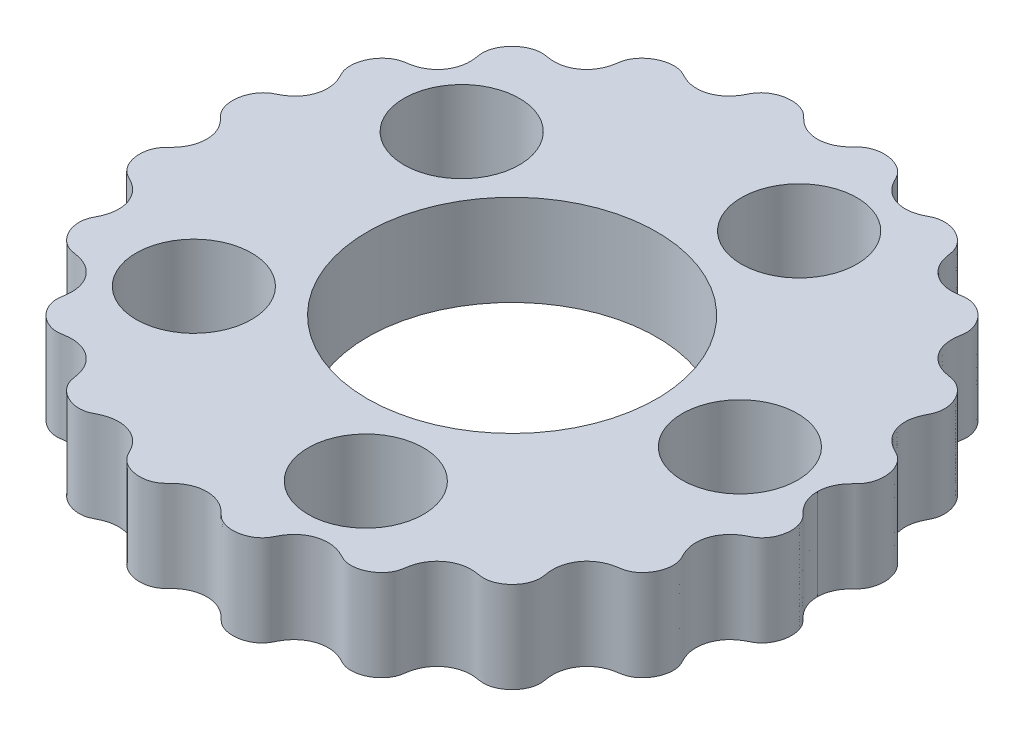
from build123d import *

# Parameters (mm, degrees)
BOSS_EXTRUDE1_START = 1
MAIN_R              = 3.8
MAIN_R_2            = 9.525
BOSS_EXTRUDE1_DEPTH = 6


with BuildPart() as part:
    # MAIN → Boss-Extrude1 (new body)
    with BuildSketch(Plane(origin=(0, 0, 0), x_dir=(1, 0, 0), z_dir=(0, 1, 0)).offset(BOSS_EXTRUDE1_START)):
        with BuildLine():
            add(Edge.make_bspline(
                [(20.1, 0), (20.1, 0.016049474), (20.10042819, 0.048265255), (20.102997256, 0.122217827), (20.111980932, 0.241772144), (20.129908594, 0.365784261), (20.160482731, 0.510263145), (20.200949467, 0.651927408), (20.251052975, 0.790295326), (20.310457626, 0.925031815), (20.405026773, 1.105489785), (20.522557341, 1.284294211), (20.663651728, 1.457905797), (20.825054173, 1.626232115), (20.958535869, 1.756480173), (21.084001151, 1.894913118), (21.19070215, 2.048527229), (21.322181138, 2.295585844), (21.436381782, 2.652555263), (21.480312105, 3.117719001), (21.403906438, 3.600484736), (21.255410516, 3.988503115), (21.088113178, 4.266212931), (20.940586592, 4.45153473), (20.783892784, 4.60313609), (20.624163597, 4.722840948), (20.449787935, 4.819202), (20.27144251, 4.907182077), (20.053826972, 5.02775347), (19.772663447, 5.220092779), (19.460268988, 5.522133789), (19.170367617, 5.979141351), (19.000054809, 6.550986456), (18.996788488, 7.09347867), (19.100354653, 7.522100535), (19.22600522, 7.825047936), (19.323069978, 8.019726709), (19.403208808, 8.17418946), (19.489181816, 8.374410265), (19.566475444, 8.682529861), (19.577864851, 9.101072271), (19.464679992, 9.610899865), (19.231249329, 10.06169528), (18.951631481, 10.396325325), (18.687316384, 10.612198661), (18.478605363, 10.738828373), (18.27672622, 10.826592284), (18.088022057, 10.880549413), (17.894642882, 10.91173651), (17.701344091, 10.941923543), (17.509848243, 10.983109484), (17.321856927, 11.038173185), (17.054914968, 11.140977964), (16.724922472, 11.324678262), (16.36394906, 11.636125273), (16.04411147, 12.112470544), (15.877508027, 12.614075001), (15.840960492, 13.04599222), (15.865791708, 13.378406904), (15.901121962, 13.611045435), (15.931904955, 13.796812252), (15.948155089, 14.03214825), (15.914834064, 14.353727504), (15.78710039, 14.744710058), (15.520698222, 15.177621098), (15.172973033, 15.516306183), (14.815895064, 15.740926601), (14.502994467, 15.864191931), (14.267579789, 15.921315139), (14.048828919, 15.944131552), (13.851076664, 15.938715819), (13.655902731, 15.909039398), (13.461304909, 15.877385295), (13.264984922, 15.856779828), (13.067674425, 15.850574212), (12.776173172, 15.865678978), (12.395590433, 15.940956671), (11.938569212, 16.137109085), (11.470553416, 16.519893429), (11.162879572, 16.97049216), (11.008945031, 17.382763009), (10.941723246, 17.700684498), (10.909391818, 17.910609622), (10.88131532, 18.078311006), (10.825896286, 18.28384026), (10.700795847, 18.566487319), (10.463238575, 18.896536387), (10.10649369, 19.20329467), (9.672270844, 19.42958383), (9.232677179, 19.551096678), (8.86266136, 19.576275628), (8.573868633, 19.540840142), (8.371319786, 19.482977256), (8.233500913, 19.429263516), (8.108846995, 19.36980218), (7.971859121, 19.298414607), (7.817815897, 19.224247184), (7.620319341, 19.142348296), (7.375175899, 19.065537121), (7.059284278, 19.008648031), (6.674311347, 19.005623312), (6.23487299, 19.085333044), (5.767240847, 19.286472452), (5.38043875, 19.585271088), (5.114615337, 19.91251743), (4.953608216, 20.183713005), (4.838337688, 20.408845665), (4.72360429, 20.635366187), (4.500791609, 20.915757491), (4.133761058, 21.194811415), (3.650572556, 21.401524152), (3.141425397, 21.474182478), (2.701085807, 21.439094531), (2.367723237, 21.345707693), (2.140403794, 21.245160735), (1.970791827, 21.139493932), (1.852684175, 21.04557956), (1.760619588, 20.960149721), (1.689220401, 20.8894654), (1.618180579, 20.81844632), (1.5460278, 20.748562596), (1.453458035, 20.663707945), (1.33785031, 20.566946935), (1.195706387, 20.46317673), (0.944410243, 20.311151454), (0.586883972, 20.160779511), (0.097411097, 20.067712928), (-0.506706748, 20.123705295), (-1.010623007, 20.324911261), (-1.364703608, 20.576832472), (-1.593509044, 20.792533664), (-1.731815119, 20.932868041), (-1.846227845, 21.041471908), (-2.001916865, 21.162825929), (-2.254686782, 21.308029569), (-2.62139071, 21.431603659), (-3.111950077, 21.479440319), (-3.664222652, 21.395690883), (-4.133751672, 21.194811679), (-4.50079738, 20.915757334), (-4.723600954, 20.635366277), (-4.838339701, 20.408845611), (-4.95360724, 20.183713031), (-5.114615975, 19.912517413), (-5.380438356, 19.585271099), (-5.767241074, 19.286472446), (-6.23487286, 19.085333048), (-6.674311426, 19.00562331), (-7.059284219, 19.008648033), (-7.37517594, 19.06553712), (-7.620319317, 19.142348297), (-7.817815908, 19.224247184), (-7.971859116, 19.298414607), (-8.108846996, 19.36980218), (-8.233500913, 19.429263515), (-8.371319785, 19.482977259), (-8.573868636, 19.540840136), (-8.862661354, 19.57627564), (-9.232677188, 19.551096661), (-9.672270832, 19.429583855), (-10.106493713, 19.203294623), (-10.463238537, 18.896536464), (-10.7007959, 18.566487209), (-10.825896203, 18.283840429), (-10.881315502, 18.078310633), (-10.909391314, 17.910610649), (-10.941724273, 17.700682406), (-11.008943, 17.382767148), (-11.162882957, 16.970485259), (-11.470548885, 16.519902665), (-11.938575656, 16.137095951), (-12.441451846, 15.92129044), (-12.874268252, 15.849349026), (-13.215931604, 15.851574086), (-13.461292159, 15.877411282), (-13.65590942, 15.909025764), (-13.851073848, 15.938721557), (-14.048830186, 15.944128969), (-14.267579135, 15.921316472), (-14.502994784, 15.864191285), (-14.815894857, 15.740927023), (-15.172973177, 15.516305889), (-15.520698126, 15.177621293), (-15.787100449, 14.744709937), (-15.914834028, 14.353727576), (-15.948155108, 14.032148211), (-15.931904943, 13.796812277), (-15.901121967, 13.611045423), (-15.865791705, 13.37840691), (-15.840960494, 13.045992217), (-15.877508026, 12.614075003), (-16.044111471, 12.112470543), (-16.363949059, 11.636125274), (-16.724922472, 11.324678262), (-17.054914968, 11.140977965), (-17.321856927, 11.038173185), (-17.509848243, 10.983109484), (-17.701344091, 10.941923543), (-17.894642882, 10.911736511), (-18.088022057, 10.880549413), (-18.27672622, 10.826592284), (-18.478605363, 10.738828373), (-18.687316384, 10.612198661), (-18.951631481, 10.396325326), (-19.231249329, 10.06169528), (-19.464679992, 9.610899865), (-19.577864851, 9.101072272), (-19.566475444, 8.682529861), (-19.489181816, 8.374410265), (-19.403208808, 8.17418946), (-19.323069978, 8.01972671), (-19.22600522, 7.825047936), (-19.100354653, 7.522100535), (-18.996788488, 7.093478671), (-19.000054809, 6.550986456), (-19.170367616, 5.979141351), (-19.460268988, 5.52213379), (-19.772663447, 5.220092779), (-20.053826972, 5.027753471), (-20.27144251, 4.907182077), (-20.449787935, 4.819202), (-20.624163597, 4.722840949), (-20.783892784, 4.60313609), (-20.940586592, 4.45153473), (-21.088113178, 4.266212931), (-21.255410516, 3.988503115), (-21.403906438, 3.600484737), (-21.480312105, 3.117719001), (-21.436381782, 2.652555264), (-21.322181138, 2.295585843), (-21.19070215, 2.048527232), (-21.084001151, 1.894913113), (-20.958535869, 1.756480188), (-20.825054173, 1.626232085), (-20.663651728, 1.45790587), (-20.522557341, 1.284294066), (-20.405026773, 1.105490041), (-20.310457626, 0.9250314), (-20.251052975, 0.790296167), (-20.200949467, 0.651926266), (-20.16048273, 0.510264245), (-20.129908594, 0.365772489), (-20.111980932, 0.24187695), (-20.102997255, 0.121794435), (-20.100428187, 0.048465762), (-20.1, 0.016049475), (-20.1, -0.02171016), (-20.100740365, -0.065537224), (-20.104071934, -0.144156063), (-20.112945474, -0.24888272), (-20.129548599, -0.371521199), (-20.158221265, -0.515938033), (-20.204239041, -0.684918351), (-20.273520329, -0.870557648), (-20.358752691, -1.050317426), (-20.458985655, -1.221772432), (-20.566593118, -1.375373307), (-20.677800781, -1.512107496), (-20.78907177, -1.633996227), (-20.89729475, -1.743281226), (-21.006487753, -1.851660443), (-21.108826998, -1.966746908), (-21.220223107, -2.123936398), (-21.346640876, -2.369339666), (-21.448804421, -2.714922855), (-21.479569019, -3.150863822), (-21.406738099, -3.6189376), (-21.253503208, -4.010050586), (-21.054801466, -4.3167693), (-20.834568393, -4.54681101), (-20.612263971, -4.704344178), (-20.325273755, -4.839756744), (-20.00852218, -5.01868956), (-19.684333315, -5.273417476), (-19.386374063, -5.622567486), (-19.165380649, -6.023790243), (-19.031235387, -6.460667693), (-18.988554194, -6.914383703), (-19.031153524, -7.309949886), (-19.121535833, -7.637383735), (-19.231185759, -7.907699698), (-19.340003931, -8.125599511), (-19.458279678, -8.349696035), (-19.534342307, -8.60201151), (-19.571226544, -8.910170929), (-19.547468686, -9.268289446), (-19.441274763, -9.663411072), (-19.230677135, -10.071117867), (-18.962617101, -10.393930449), (-18.69456545, -10.607356203), (-18.463252178, -10.732656246), (-18.290990166, -10.798741664), (-18.148391024, -10.836569426), (-18.003178925, -10.861951575), (-17.857558256, -10.884265091), (-17.641121776, -10.923327988), (-17.357371949, -10.996845119), (-17.017888737, -11.137017594), (-16.649928165, -11.379284126), (-16.334369672, -11.690450594), (-16.08502107, -12.060144405), (-15.913420845, -12.474413535), (-15.837321702, -12.861692439), (-15.826145974, -13.198469455), (-15.849040745, -13.486913028), (-15.886691352, -13.72544992), (-15.927162315, -13.973460833), (-15.917763897, -14.234537693), (-15.855442161, -14.535749675), (-15.720933739, -14.865237104), (-15.494128005, -15.210409224), (-15.157431132, -15.538376323), (-14.781408984, -15.76822783), (-14.431758379, -15.886583939), (-14.146771031, -15.923570894), (-13.940431266, -15.917988379), (-13.777045476, -15.895710114), (-13.573931264, -15.861918407), (-13.311432759, -15.830171544), (-12.987810263, -15.826054921), (-12.60914423, -15.881308187), (-12.229522049, -16.007230154), (-11.876954427, -16.1993096), (-11.563437142, -16.452525279), (-11.299633908, -16.759177641), (-11.094221009, -17.109263485), (-10.975435401, -17.427961134), (-10.912460643, -17.694217159), (-10.877730043, -17.89918615), (-10.856064449, -18.0401656), (-10.822771699, -18.215436473), (-10.756071908, -18.419634752), (-10.618321052, -18.683058453), (-10.378992613, -18.978083153), (-10.050155805, -19.245203321), (-9.632890947, -19.453548744), (-9.223494552, -19.555845862), (-8.883602633, -19.569595951), (-8.624829389, -19.53453372), (-8.448145167, -19.486752645), (-8.311702249, -19.433795975), (-8.180359463, -19.369482763), (-8.050463002, -19.302491925), (-7.848916598, -19.205079035), (-7.567592994, -19.094767002), (-7.195942419, -19.007772682), (-6.736051918, -18.99379513), (-6.286118287, -19.073202806), (-5.86481401, -19.240976426), (-5.488630496, -19.487915279), (-5.210069989, -19.761933205), (-5.011673366, -20.030377918), (-4.88402849, -20.249288085), (-4.804678509, -20.403650404), (-4.722737461, -20.564714017), (-4.627134448, -20.726897435), (-4.486551992, -20.896721045), (-4.26137917, -21.094571853), (-3.962456049, -21.275011587), (-3.592508535, -21.411382192), (-3.15817733, -21.475362584), (-2.768745757, -21.452327592), (-2.437761406, -21.369500955), (-2.168271589, -21.248422688), (-1.958055932, -21.110173628), (-1.785447744, -20.94091701), (-1.622730612, -20.775668556), (-1.414624707, -20.592569598), (-1.152020167, -20.405823234), (-0.814799819, -20.236460165), (-0.395794796, -20.11756634), (0.04306138, -20.082050137), (0.484607542, -20.134421982), (0.91116178, -20.274957645), (1.271012064, -20.478453824), (1.534676394, -20.691199523), (1.722859475, -20.876678362), (1.857461379, -21.012098347), (1.972236287, -21.113107357), (2.128810544, -21.222996315), (2.369691528, -21.346150999), (2.705938739, -21.446074355), (3.128997453, -21.478869711), (3.583297764, -21.414776575), (3.962473712, -21.275005607), (4.261368893, -21.094575333), (4.486558386, -20.89671888), (4.627130565, -20.726898749), (4.722739327, -20.564713386), (4.804677846, -20.403650629), (4.884028711, -20.249288011), (5.011673252, -20.030377957), (5.210070055, -19.761933183), (5.488630456, -19.487915292), (5.864814032, -19.240976419), (6.286118273, -19.073202811), (6.736051926, -18.993795127), (7.195942412, -19.007772684), (7.567592997, -19.094767), (7.848916597, -19.205079036), (8.050463002, -19.302491925), (8.180359447, -19.369482757), (8.311702337, -19.433796008), (8.448144957, -19.486752569), (8.624829844, -19.534533887), (8.883601698, -19.569595609), (9.22349619, -19.555846462), (9.632888472, -19.453547838), (10.050159599, -19.245204711), (10.378986666, -18.978080976), (10.61833073, -18.683061996), (10.756055979, -18.419628921), (10.822802865, -18.215447882), (10.862648263, -18.005084067), (10.897177746, -17.764021208), (10.9630027, -17.461561655), (11.094176446, -17.109247173), (11.299658013, -16.759186465), (11.563423205, -16.452520178), (11.876963914, -16.199313073), (12.229515738, -16.007227845), (12.609148784, -15.881309854), (12.987807102, -15.826053764), (13.311434593, -15.830172215), (13.57393037, -15.861918081), (13.777045847, -15.895710251), (13.940431152, -15.917988338), (14.14677108, -15.923570912), (14.431758349, -15.886583928), (14.781409003, -15.768227837), (15.15743112, -15.53837632), (15.494128012, -15.210409227), (15.720933734, -14.865237102), (15.855442163, -14.535749676), (15.917763895, -14.234537693), (15.927162316, -13.973460834), (15.886691351, -13.72544992), (15.849040745, -13.486913028), (15.826145973, -13.198469455), (15.837321702, -12.861692439), (15.913420844, -12.474413536), (16.085021069, -12.060144406), (16.334369672, -11.690450595), (16.649928164, -11.379284126), (17.017888736, -11.137017594), (17.357371949, -10.99684512), (17.641121776, -10.923327988), (17.857558256, -10.884265091), (18.003178929, -10.86195157), (18.148391004, -10.836569454), (18.290990211, -10.798741599), (18.463252081, -10.732656387), (18.694565648, -10.607355915), (18.96261675, -10.393930958), (19.23067766, -10.071117106), (19.441273966, -9.663412226), (19.54746991, -9.268287674), (19.571224635, -8.910173694), (19.534345549, -8.602006815), (19.458272769, -8.34970604), (19.340018236, -8.125578794), (19.231160509, -7.907736265), (19.14282673, -7.689724945), (19.076304167, -7.473725478), (19.019020301, -7.196875925), (18.993846489, -6.857849588), (19.031255544, -6.460638503), (19.165368749, -6.023807477), (19.386381461, -5.622556771), (19.684328371, -5.273424636), (20.008525148, -5.018685262), (20.325272171, -4.839759039), (20.612264677, -4.704343157), (20.834568029, -4.546811538), (21.054801685, -4.316768984), (21.253503069, -4.010050789), (21.40673819, -3.618937469), (21.479568958, -3.150863911), (21.448804463, -2.714922796), (21.346640853, -2.3693397), (21.220223118, -2.123936381), (21.108826992, -1.966746916), (21.006487755, -1.85166044), (20.897294749, -1.743281222), (20.78907177, -1.633996261), (20.677800781, -1.512107366), (20.566593118, -1.375373687), (20.458985655, -1.221771519), (20.358752691, -1.050319311), (20.273520329, -0.870553985), (20.204239041, -0.684923618), (20.158221265, -0.5159414), (20.129548599, -0.371490762), (20.112945473, -0.248940239), (20.104071929, -0.144509512), (20.100740368, -0.065175164), (20.1, -0.021710161), (20.1, 0)],
                knots=[0.063609002, 0.063609002, 0.063609002, 0.063609002, 0.063609002, 0.064458074, 0.065307146, 0.06700529, 0.068703435, 0.070401579, 0.072099723, 0.073797867, 0.075496012, 0.077194156, 0.081499833, 0.083652672, 0.085805511, 0.087958349, 0.090111188, 0.092264027, 0.094416865, 0.100851345, 0.107285824, 0.113598849, 0.116755361, 0.119911874, 0.122207841, 0.124503809, 0.126799776, 0.129095744, 0.131391711, 0.133687679, 0.138279613, 0.144786754, 0.151293894, 0.158381972, 0.16547005, 0.169487075, 0.171495587, 0.1735041, 0.175512612, 0.177521124, 0.181538149, 0.188088893, 0.194639636, 0.201358698, 0.204718229, 0.20807776, 0.210336636, 0.212595511, 0.214854386, 0.217113262, 0.219372137, 0.221631013, 0.223889888, 0.226148764, 0.232563486, 0.238978207, 0.245649795, 0.252321382, 0.256667064, 0.258839905, 0.261012746, 0.263185587, 0.265358428, 0.269704109, 0.275848778, 0.281993447, 0.288591296, 0.291890221, 0.295189145, 0.297465562, 0.29974198, 0.302018397, 0.304294814, 0.306571231, 0.308847648, 0.311124065, 0.313400483, 0.320031256, 0.32666203, 0.333803829, 0.340945629, 0.344868761, 0.346830327, 0.348791893, 0.350753459, 0.352715025, 0.356638156, 0.362992656, 0.369347155, 0.374206536, 0.379065918, 0.383918614, 0.386344962, 0.387558136, 0.38877131, 0.390744311, 0.392717312, 0.394690313, 0.396663314, 0.400609317, 0.404555319, 0.409450074, 0.414344829, 0.421090178, 0.427835527, 0.431732176, 0.433680501, 0.435628826, 0.439525475, 0.443422124, 0.450061542, 0.456700961, 0.46350218, 0.46690279, 0.4703034, 0.472622355, 0.47494131, 0.476100788, 0.477260265, 0.478419743, 0.479579221, 0.480738698, 0.481898176, 0.484217131, 0.486536087, 0.488855042, 0.495440463, 0.502025885, 0.509259804, 0.516493724, 0.520132717, 0.521952213, 0.523771709, 0.525591206, 0.527410702, 0.531049695, 0.537174367, 0.543299039, 0.549938458, 0.556577876, 0.560474525, 0.564371174, 0.566319499, 0.568267824, 0.572164473, 0.578909822, 0.585655171, 0.590549926, 0.595444681, 0.599390683, 0.603336686, 0.605309687, 0.607282688, 0.609255689, 0.61122869, 0.612441864, 0.613655038, 0.616081386, 0.620934082, 0.625793464, 0.630652845, 0.637007344, 0.643361844, 0.647284975, 0.649246541, 0.651208107, 0.653169673, 0.655131239, 0.659054371, 0.666196171, 0.67333797, 0.679968744, 0.686599517, 0.691152352, 0.693428769, 0.695705186, 0.697981603, 0.70025802, 0.702534438, 0.704810855, 0.708109779, 0.711408704, 0.718006553, 0.724151222, 0.730295891, 0.734641572, 0.736814413, 0.738987254, 0.741160095, 0.743332936, 0.747678618, 0.754350205, 0.761021793, 0.767436514, 0.773851236, 0.776110112, 0.778368987, 0.780627863, 0.782886738, 0.785145614, 0.787404489, 0.789663364, 0.79192224, 0.795281771, 0.798641302, 0.805360364, 0.811911107, 0.818461851, 0.822478876, 0.824487388, 0.8264959, 0.828504413, 0.830512925, 0.83452995, 0.841618028, 0.848706106, 0.855213246, 0.861720387, 0.866312321, 0.868608289, 0.870904256, 0.873200224, 0.875496191, 0.877792159, 0.880088126, 0.883244639, 0.886401151, 0.892714176, 0.899148655, 0.905583135, 0.907735973, 0.909888812, 0.912041651, 0.914194489, 0.916347328, 0.918500167, 0.922805844, 0.924503988, 0.926202133, 0.927900277, 0.929598421, 0.931296565, 0.93299471, 0.934692854, 0.935541926, 0.936390998, 0.936390998, 0.936390998, 0.93753954, 0.938688082, 0.939836624, 0.940985165, 0.943282249, 0.945579333, 0.947876416, 0.9501735, 0.952470583, 0.954767667, 0.956547976, 0.958328284, 0.960108593, 0.961888902, 0.96366921, 0.965449519, 0.969010136, 0.974615965, 0.980221794, 0.985496461, 0.990771127, 0.993903217, 0.997035308, 1.000167399, 1.00329949, 1.008576822, 1.013854154, 1.019131487, 1.024408819, 1.029635531, 1.034862243, 1.040088955, 1.042702312, 1.045315668, 1.048344949, 1.05137423, 1.054403511, 1.057432793, 1.06265791, 1.067883028, 1.073200187, 1.078517346, 1.081927608, 1.083632739, 1.08533787, 1.087043002, 1.088748133, 1.090453264, 1.092158395, 1.097225308, 1.102292221, 1.107359134, 1.112426048, 1.117611695, 1.122797343, 1.127982991, 1.130575815, 1.133168639, 1.136171384, 1.139174129, 1.142176874, 1.145179619, 1.150361937, 1.155544256, 1.161155886, 1.166767516, 1.170581224, 1.172488079, 1.174394933, 1.176301787, 1.178208641, 1.18202235, 1.186627433, 1.191232516, 1.195837599, 1.200442682, 1.205116059, 1.209789435, 1.214462812, 1.219136189, 1.220786941, 1.222437693, 1.224088444, 1.225739196, 1.2290407, 1.232342203, 1.237773978, 1.243205753, 1.24848755, 1.253769348, 1.2571526, 1.258844225, 1.260535851, 1.262227477, 1.263919103, 1.265610729, 1.267302354, 1.272591297, 1.27788024, 1.283169183, 1.288458126, 1.293594209, 1.298730291, 1.303866374, 1.306434415, 1.309002456, 1.310452146, 1.311901836, 1.314801216, 1.317700595, 1.320599975, 1.325733449, 1.330866922, 1.335823509, 1.340780095, 1.343673181, 1.346566267, 1.349459352, 1.352352438, 1.354832904, 1.357313371, 1.362274305, 1.367235238, 1.372196172, 1.377359301, 1.382522431, 1.387685561, 1.39284869, 1.396383657, 1.39815114, 1.399918623, 1.401686106, 1.403453589, 1.406988556, 1.412394883, 1.41780121, 1.422934684, 1.428068158, 1.430967537, 1.433866917, 1.436766297, 1.438215987, 1.439665676, 1.442233718, 1.444801759, 1.449937841, 1.455073924, 1.460210007, 1.465498949, 1.470787892, 1.476076835, 1.481365778, 1.483057404, 1.48474903, 1.486440656, 1.488132281, 1.489823907, 1.491515533, 1.494898785, 1.500180582, 1.50546238, 1.510894155, 1.516325929, 1.519627433, 1.522928937, 1.524579688, 1.52623044, 1.529531944, 1.53420532, 1.538878697, 1.543552074, 1.548225451, 1.552830534, 1.557435617, 1.5620407, 1.566645783, 1.570459491, 1.572366345, 1.5742732, 1.576180054, 1.578086908, 1.581900617, 1.587512247, 1.593123877, 1.598306195, 1.603488514, 1.606491259, 1.609494004, 1.612496749, 1.615499494, 1.618092318, 1.620685142, 1.625870789, 1.631056437, 1.636242085, 1.641308998, 1.646375911, 1.651442825, 1.656509738, 1.658214869, 1.65992, 1.661625131, 1.663330262, 1.665035393, 1.666740524, 1.670150786, 1.675467945, 1.680785105, 1.686010222, 1.69123534, 1.694264621, 1.697293903, 1.700323184, 1.703352465, 1.705965821, 1.708579177, 1.711192533, 1.713805889, 1.719032601, 1.724259314, 1.729536646, 1.734813978, 1.740091311, 1.745368643, 1.748500734, 1.751632824, 1.754764915, 1.757897006, 1.763171672, 1.768446338, 1.774052167, 1.779657997, 1.783218614, 1.784998922, 1.786779231, 1.78855954, 1.790339848, 1.792120157, 1.793900466, 1.796197549, 1.798494633, 1.800791716, 1.8030888, 1.805385884, 1.807682967, 1.808831509, 1.809980051, 1.811128593, 1.812277134, 1.812277134, 1.812277134, 1.812277134, 1.812277134], degree=4))
        make_face()
        with Locations((15, 0)):
            Circle(MAIN_R, mode=Mode.SUBTRACT)
        with Locations((4.635254916, -14.265847744)):
            Circle(MAIN_R, mode=Mode.SUBTRACT)
        with Locations((-12.135254916, -8.816778784)):
            Circle(MAIN_R, mode=Mode.SUBTRACT)
        with Locations((-12.135254916, 8.816778784)):
            Circle(MAIN_R, mode=Mode.SUBTRACT)
        with Locations((4.635254916, 14.265847744)):
            Circle(MAIN_R, mode=Mode.SUBTRACT)
        Circle(MAIN_R_2, mode=Mode.SUBTRACT)
    extrude(amount=BOSS_EXTRUDE1_DEPTH)


solid = part.part
